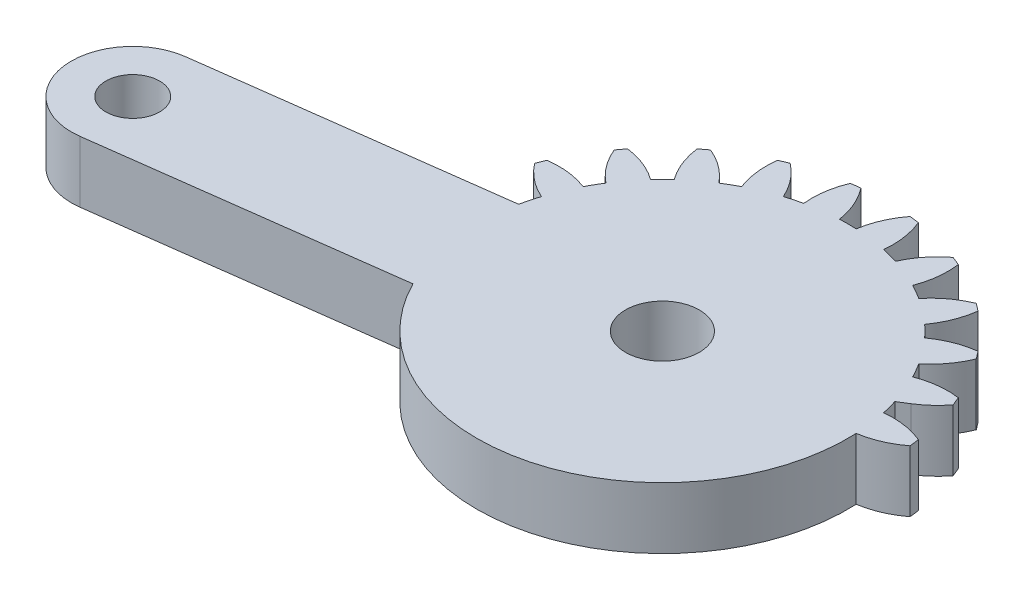
from build123d import *
from build123d.topology import SkipClean

# Parameters (mm, degrees)
SKETCH1_R           = 1.5
BOSS_EXTRUDE1_DEPTH = 4
BOSS_EXTRUDE2_START = -4
SKETCH3_R           = 1.5
SKETCH3_R_2         = 1.75
BOSS_EXTRUDE2_DEPTH = 4
CUT_EXTRUDE1_START  = -4
CUT_EXTRUDE1_DEPTH  = 4
CUT_EXTRUDE2_REACH  = 49.073
SKETCH5_R           = 2.4


with BuildPart() as part:
    # Sketch1 → Boss-Extrude1 (new body)
    with BuildSketch(Plane(origin=(0, 0, 0), x_dir=(1, 0, 0), z_dir=(0, 1, 0))):
        with BuildLine():
            Line((20.643657446, 4), (2.081641936, 4))
            ThreePointArc((2.081641936, 4), (2.861028333, 4.588201733), (3.521749436, 5.30713988))
            ThreePointArc((3.521749436, 5.30713988), (3.405395609, 5.596745198), (3.282888305, 5.883801663))
            ThreePointArc((3.282888305, 5.883801663), (1.93527598, 5.894040025), (0.627094961, 5.57027124))
            ThreePointArc((0.627094961, 5.57027124), (0.366286148, 6.046375), (0.084372603, 6.510293938))
            ThreePointArc((0.084372603, 6.510293938), (1.018855105, 7.48132754), (1.683794586, 8.65351323))
            ThreePointArc((1.683794586, 8.65351323), (1.496450048, 8.903135899), (1.303821399, 9.148703928))
            ThreePointArc((1.303821399, 9.148703928), (-0.000522033, 8.809805691), (-1.180330337, 8.158486898))
            ThreePointArc((-1.180330337, 8.158486898), (-1.555477026, 8.550865528), (-1.947855656, 8.926012217))
            ThreePointArc((-1.947855656, 8.926012217), (-1.296536862, 10.105820521), (-0.957638625, 11.410163953))
            ThreePointArc((-0.957638625, 11.410163953), (-1.203206655, 11.602792602), (-1.452829324, 11.79013714))
            ThreePointArc((-1.452829324, 11.79013714), (-2.625015014, 11.125197659), (-3.596048616, 10.190715157))
            ThreePointArc((-3.596048616, 10.190715157), (-4.059967554, 10.472628702), (-4.536071314, 10.733437515))
            ThreePointArc((-4.536071314, 10.733437515), (-4.212302529, 12.041618533), (-4.222540891, 13.389230859))
            ThreePointArc((-4.222540891, 13.389230859), (-4.509597355, 13.511738163), (-4.799202674, 13.62809199))
            ThreePointArc((-4.799202674, 13.62809199), (-5.759348103, 12.682425791), (-6.455432668, 11.528463019))
            ThreePointArc((-6.455432668, 11.528463019), (-6.976508546, 11.680699536), (-7.503891752, 11.809396783))
            ThreePointArc((-7.503891752, 11.809396783), (-7.529737283, 13.156800143), (-7.888414517, 14.455843809))
            ThreePointArc((-7.888414517, 14.455843809), (-8.197396993, 14.499881098), (-8.507248835, 14.537314892))
            ThreePointArc((-8.507248835, 14.537314892), (-9.18992168, 13.375367565), (-9.563620196, 12.080565177))
            ThreePointArc((-9.563620196, 12.080565177), (-10.106342554, 12.09275), (-10.649064912, 12.080565177))
            ThreePointArc((-10.649064912, 12.080565177), (-11.022763428, 13.375367565), (-11.705436272, 14.537314892))
            ThreePointArc((-11.705436272, 14.537314892), (-12.015288115, 14.499881098), (-12.324270591, 14.455843809))
            ThreePointArc((-12.324270591, 14.455843809), (-12.682947825, 13.156800143), (-12.708793355, 11.809396783))
            ThreePointArc((-12.708793355, 11.809396783), (-13.236176561, 11.680699536), (-13.757252439, 11.528463019))
            ThreePointArc((-13.757252439, 11.528463019), (-14.453337005, 12.682425791), (-15.413482434, 13.62809199))
            ThreePointArc((-15.413482434, 13.62809199), (-15.703087752, 13.511738163), (-15.990144217, 13.389230859))
            ThreePointArc((-15.990144217, 13.389230859), (-16.000382579, 12.041618533), (-15.676613793, 10.733437515))
            ThreePointArc((-15.676613793, 10.733437515), (-16.152717554, 10.472628702), (-16.616636492, 10.190715157))
            ThreePointArc((-16.616636492, 10.190715157), (-17.587670094, 11.125197659), (-18.759855783, 11.79013714))
            ThreePointArc((-18.759855783, 11.79013714), (-19.009478453, 11.602792602), (-19.255046482, 11.410163953))
            ThreePointArc((-19.255046482, 11.410163953), (-18.916148245, 10.105820521), (-18.264829452, 8.926012217))
            ThreePointArc((-18.264829452, 8.926012217), (-18.657208082, 8.550865528), (-19.032354771, 8.158486898))
            ThreePointArc((-19.032354771, 8.158486898), (-20.212163074, 8.809805691), (-21.516506507, 9.148703928))
            ThreePointArc((-21.516506507, 9.148703928), (-21.709135156, 8.903135899), (-21.896479694, 8.65351323))
            ThreePointArc((-21.896479694, 8.65351323), (-21.231540213, 7.48132754), (-20.297057711, 6.510293938))
            ThreePointArc((-20.297057711, 6.510293938), (-20.578971255, 6.046375), (-20.839780068, 5.57027124))
            ThreePointArc((-20.839780068, 5.57027124), (-22.147961087, 5.894040025), (-23.495573413, 5.883801663))
            ThreePointArc((-23.495573413, 5.883801663), (-23.618080717, 5.596745198), (-23.734434544, 5.30713988))
            ThreePointArc((-23.734434544, 5.30713988), (-22.788768345, 4.346994451), (-21.634805572, 3.650909885))
            ThreePointArc((-21.634805572, 3.650909885), (-21.78704209, 3.129834008), (-21.915739337, 2.602450802))
            ThreePointArc((-21.915739337, 2.602450802), (-23.263142697, 2.576605271), (-24.562186363, 2.217928037))
            ThreePointArc((-24.562186363, 2.217928037), (-24.606223651, 1.908945561), (-24.643657446, 1.599093719))
            ThreePointArc((-24.643657446, 1.599093719), (-23.481710119, 0.916420874), (-22.186907731, 0.542722358))
            ThreePointArc((-22.186907731, 0.542722358), (-22.199092554, 0), (-22.186907731, -0.542722358))
            ThreePointArc((-22.186907731, -0.542722358), (-23.481710119, -0.916420874), (-24.643657446, -1.599093719))
            ThreePointArc((-24.643657446, -1.599093719), (-24.606223651, -1.908945561), (-24.562186363, -2.217928037))
            ThreePointArc((-24.562186363, -2.217928037), (-23.263142697, -2.576605271), (-21.915739337, -2.602450802))
            ThreePointArc((-21.915739337, -2.602450802), (-21.78704209, -3.129834008), (-21.634805572, -3.650909885))
            ThreePointArc((-21.634805572, -3.650909885), (-22.788768345, -4.346994451), (-23.734434544, -5.30713988))
            ThreePointArc((-23.734434544, -5.30713988), (-23.618080717, -5.596745198), (-23.495573413, -5.883801663))
            ThreePointArc((-23.495573413, -5.883801663), (-22.147961087, -5.894040025), (-20.839780068, -5.57027124))
            ThreePointArc((-20.839780068, -5.57027124), (-20.578971255, -6.046375), (-20.297057711, -6.510293938))
            ThreePointArc((-20.297057711, -6.510293938), (-21.231540213, -7.48132754), (-21.896479694, -8.65351323))
            ThreePointArc((-21.896479694, -8.65351323), (-21.709135156, -8.903135899), (-21.516506507, -9.148703928))
            ThreePointArc((-21.516506507, -9.148703928), (-20.212163074, -8.809805691), (-19.032354771, -8.158486898))
            ThreePointArc((-19.032354771, -8.158486898), (-18.657208082, -8.550865528), (-18.264829452, -8.926012217))
            ThreePointArc((-18.264829452, -8.926012217), (-18.916148245, -10.105820521), (-19.255046482, -11.410163953))
            ThreePointArc((-19.255046482, -11.410163953), (-19.009478453, -11.602792602), (-18.759855783, -11.79013714))
            ThreePointArc((-18.759855783, -11.79013714), (-17.587670094, -11.125197659), (-16.616636492, -10.190715157))
            ThreePointArc((-16.616636492, -10.190715157), (-16.152717554, -10.472628702), (-15.676613793, -10.733437515))
            ThreePointArc((-15.676613793, -10.733437515), (-16.000382579, -12.041618533), (-15.990144217, -13.389230859))
            ThreePointArc((-15.990144217, -13.389230859), (-15.703087752, -13.511738163), (-15.413482434, -13.62809199))
            ThreePointArc((-15.413482434, -13.62809199), (-14.453337005, -12.682425791), (-13.757252439, -11.528463019))
            ThreePointArc((-13.757252439, -11.528463019), (-13.236176561, -11.680699536), (-12.708793355, -11.809396783))
            ThreePointArc((-12.708793355, -11.809396783), (-12.682947825, -13.156800143), (-12.324270591, -14.455843809))
            ThreePointArc((-12.324270591, -14.455843809), (-12.015288115, -14.499881098), (-11.705436272, -14.537314892))
            ThreePointArc((-11.705436272, -14.537314892), (-11.022763428, -13.375367565), (-10.649064912, -12.080565177))
            ThreePointArc((-10.649064912, -12.080565177), (-10.106342554, -12.09275), (-9.563620196, -12.080565177))
            ThreePointArc((-9.563620196, -12.080565177), (-9.18992168, -13.375367565), (-8.507248835, -14.537314892))
            ThreePointArc((-8.507248835, -14.537314892), (-8.197396993, -14.499881098), (-7.888414517, -14.455843809))
            ThreePointArc((-7.888414517, -14.455843809), (-7.529737283, -13.156800143), (-7.503891752, -11.809396783))
            ThreePointArc((-7.503891752, -11.809396783), (-6.976508546, -11.680699536), (-6.455432668, -11.528463019))
            ThreePointArc((-6.455432668, -11.528463019), (-5.759348103, -12.682425791), (-4.799202674, -13.62809199))
            ThreePointArc((-4.799202674, -13.62809199), (-4.509597355, -13.511738163), (-4.222540891, -13.389230859))
            ThreePointArc((-4.222540891, -13.389230859), (-4.212302529, -12.041618533), (-4.536071314, -10.733437515))
            ThreePointArc((-4.536071314, -10.733437515), (-4.059967554, -10.472628702), (-3.596048616, -10.190715157))
            ThreePointArc((-3.596048616, -10.190715157), (-2.625015014, -11.125197659), (-1.452829324, -11.79013714))
            ThreePointArc((-1.452829324, -11.79013714), (-1.203206655, -11.602792602), (-0.957638625, -11.410163953))
            ThreePointArc((-0.957638625, -11.410163953), (-1.296536862, -10.105820521), (-1.947855656, -8.926012217))
            ThreePointArc((-1.947855656, -8.926012217), (-1.555477026, -8.550865528), (-1.180330337, -8.158486898))
            ThreePointArc((-1.180330337, -8.158486898), (-0.000522033, -8.809805691), (1.303821399, -9.148703928))
            ThreePointArc((1.303821399, -9.148703928), (1.496450048, -8.903135899), (1.683794586, -8.65351323))
            ThreePointArc((1.683794586, -8.65351323), (1.018855105, -7.48132754), (0.084372603, -6.510293938))
            ThreePointArc((0.084372603, -6.510293938), (0.366286148, -6.046375), (0.627094961, -5.57027124))
            ThreePointArc((0.627094961, -5.57027124), (1.93527598, -5.894040025), (3.282888305, -5.883801663))
            ThreePointArc((3.282888305, -5.883801663), (3.405395609, -5.596745198), (3.521749436, -5.30713988))
            ThreePointArc((3.521749436, -5.30713988), (2.861028333, -4.588201733), (2.081641936, -4))
            Line((2.081641936, -4), (20.643657446, -4))
            ThreePointArc((20.643657446, -4), (24.643657446, 0), (20.643657446, 4))
        make_face()
        with Locations((-10.106342554, 0)):
            Circle(SKETCH1_R, mode=Mode.SUBTRACT)
        with Locations((20.643657446, 0)):
            Circle(SKETCH1_R, mode=Mode.SUBTRACT)
    extrude(amount=BOSS_EXTRUDE1_DEPTH)

    # Sketch3 → Boss-Extrude2 (add)
    with BuildSketch(Plane(origin=(0, 4, 0), x_dir=(1, 0, 0), z_dir=(0, 1, 0)).offset(BOSS_EXTRUDE2_START)):
        with BuildLine():
            Line((-10.628447323, 3.965779445), (-41.11537681, -0.047900965))
            ThreePointArc((-41.11537681, -0.047900965), (-44.559051487, -4.53578518), (-40.071167272, -7.979459856))
            Line((-40.071167272, -7.979459856), (-9.584237785, -3.965779445))
            ThreePointArc((-9.584237785, -3.965779445), (-6.140563108, 0.522104769), (-10.628447323, 3.965779445))
        make_face()
        with Locations((-10.106342554, 0)):
            Circle(SKETCH3_R, mode=Mode.SUBTRACT)
        with Locations((-40.593272041, -4.013680411)):
            Circle(SKETCH3_R_2, mode=Mode.SUBTRACT)
    extrude(amount=BOSS_EXTRUDE2_DEPTH)

    # Sketch4 → Cut-Extrude1 (cut)
    with SkipClean():  # the faces are left unmerged after this step: merging them gives an invalid solid
        with BuildSketch(Plane(origin=(0, 4, 0), x_dir=(1, 0, 0), z_dir=(0, 1, 0)).offset(CUT_EXTRUDE1_START)):
            with BuildLine():
                ThreePointArc((20.643657446, -4), (24.643657446, 0), (20.643657446, 4))
                Line((20.643657446, 4), (2.081641936, 4))
                Line((2.081641936, 4), (1.43808022, 3.600125745))
                ThreePointArc((1.43808022, 3.600125745), (1.581217534, 3.104116905), (1.70305423, 2.602450802))
                ThreePointArc((1.70305423, 2.602450802), (3.050457589, 2.576605271), (4.349501255, 2.217928037))
                ThreePointArc((4.349501255, 2.217928037), (4.393538544, 1.908945561), (4.430972339, 1.599093719))
                ThreePointArc((4.430972339, 1.599093719), (3.269025011, 0.916420874), (1.974222624, 0.542722358))
                ThreePointArc((1.974222624, 0.542722358), (1.70305423, -2.602450802), (0.627094961, -5.57027124))
                ThreePointArc((0.627094961, -5.57027124), (1.93527598, -5.894040025), (3.282888305, -5.883801663))
                ThreePointArc((3.282888305, -5.883801663), (3.405395609, -5.596745198), (3.521749436, -5.30713988))
                ThreePointArc((3.521749436, -5.30713988), (2.861028333, -4.588201733), (2.081641936, -4))
                Line((2.081641936, -4), (20.643657446, -4))
            make_face()
            with BuildLine():
                ThreePointArc((1.683794586, -8.65351323), (1.018855105, -7.48132754), (0.084372603, -6.510293938))
                ThreePointArc((0.084372603, -6.510293938), (-0.512518948, -7.361599771), (-1.180330337, -8.158486898))
                ThreePointArc((-1.180330337, -8.158486898), (-0.000522033, -8.809805691), (1.303821399, -9.148703928))
                ThreePointArc((1.303821399, -9.148703928), (1.496450048, -8.903135899), (1.683794586, -8.65351323))
            make_face()
            with BuildLine():
                ThreePointArc((-0.957638625, -11.410163953), (-1.296536862, -10.105820521), (-1.947855656, -8.926012217))
                ThreePointArc((-1.947855656, -8.926012217), (-2.744742783, -9.593823606), (-3.596048616, -10.190715157))
                ThreePointArc((-3.596048616, -10.190715157), (-2.625015014, -11.125197659), (-1.452829324, -11.79013714))
                ThreePointArc((-1.452829324, -11.79013714), (-1.203206655, -11.602792602), (-0.957638625, -11.410163953))
            make_face()
            with BuildLine():
                ThreePointArc((-4.222540891, -13.389230859), (-4.212302529, -12.041618533), (-4.536071314, -10.733437515))
                ThreePointArc((-4.536071314, -10.733437515), (-5.478647477, -11.172244217), (-6.455432668, -11.528463019))
                ThreePointArc((-6.455432668, -11.528463019), (-5.759348103, -12.682425791), (-4.799202674, -13.62809199))
                ThreePointArc((-4.799202674, -13.62809199), (-4.509597355, -13.511738163), (-4.222540891, -13.389230859))
            make_face()
            with BuildLine():
                ThreePointArc((-7.888414517, -14.455843809), (-7.529737283, -13.156800143), (-7.503891752, -11.809396783))
                ThreePointArc((-7.503891752, -11.809396783), (-8.527921943, -11.989294847), (-9.563620196, -12.080565177))
                ThreePointArc((-9.563620196, -12.080565177), (-9.18992168, -13.375367565), (-8.507248835, -14.537314892))
                ThreePointArc((-8.507248835, -14.537314892), (-8.197396993, -14.499881098), (-7.888414517, -14.455843809))
            make_face()
            with BuildLine():
                ThreePointArc((-11.705436272, -14.537314892), (-11.022763428, -13.375367565), (-10.649064912, -12.080565177))
                ThreePointArc((-10.649064912, -12.080565177), (-11.684763165, -11.989294847), (-12.708793355, -11.809396783))
                ThreePointArc((-12.708793355, -11.809396783), (-12.682947825, -13.156800143), (-12.324270591, -14.455843809))
                ThreePointArc((-12.324270591, -14.455843809), (-12.015288115, -14.499881098), (-11.705436272, -14.537314892))
            make_face()
            with BuildLine():
                ThreePointArc((-15.413482434, -13.62809199), (-14.453337005, -12.682425791), (-13.757252439, -11.528463019))
                ThreePointArc((-13.757252439, -11.528463019), (-14.734037631, -11.172244217), (-15.676613793, -10.733437515))
                ThreePointArc((-15.676613793, -10.733437515), (-16.000382579, -12.041618533), (-15.990144217, -13.389230859))
                ThreePointArc((-15.990144217, -13.389230859), (-15.703087752, -13.511738163), (-15.413482434, -13.62809199))
            make_face()
            with BuildLine():
                ThreePointArc((-18.759855783, -11.79013714), (-17.587670094, -11.125197659), (-16.616636492, -10.190715157))
                ThreePointArc((-16.616636492, -10.190715157), (-17.467942324, -9.593823606), (-18.264829452, -8.926012217))
                ThreePointArc((-18.264829452, -8.926012217), (-18.916148245, -10.105820521), (-19.255046482, -11.410163953))
                ThreePointArc((-19.255046482, -11.410163953), (-19.009478453, -11.602792602), (-18.759855783, -11.79013714))
            make_face()
            with BuildLine():
                ThreePointArc((-21.516506507, -9.148703928), (-20.212163074, -8.809805691), (-19.032354771, -8.158486898))
                ThreePointArc((-19.032354771, -8.158486898), (-19.70016616, -7.361599771), (-20.297057711, -6.510293938))
                ThreePointArc((-20.297057711, -6.510293938), (-21.231540213, -7.48132754), (-21.896479694, -8.65351323))
                ThreePointArc((-21.896479694, -8.65351323), (-21.709135156, -8.903135899), (-21.516506507, -9.148703928))
            make_face()
            with BuildLine():
                ThreePointArc((-21.942853375, 2.47620963), (-21.92946485, 2.539366405), (-21.915739337, 2.602450802))
                ThreePointArc((-21.915739337, 2.602450802), (-23.263142697, 2.576605271), (-24.562186363, 2.217928037))
                ThreePointArc((-24.562186363, 2.217928037), (-24.56889027, 2.173784387), (-24.575459377, 2.129620475))
                Line((-24.575459377, 2.129620475), (-21.942853375, 2.47620963))
            make_face()
            with BuildLine():
                ThreePointArc((-23.495573413, -5.883801663), (-22.147961087, -5.894040025), (-20.839780068, -5.57027124))
                ThreePointArc((-20.839780068, -5.57027124), (-20.869365339, -5.512888815), (-20.898643838, -5.455349261))
                Line((-20.898643838, -5.455349261), (-23.531249839, -5.801938416))
                ThreePointArc((-23.531249839, -5.801938416), (-23.513474108, -5.842897269), (-23.495573413, -5.883801663))
            make_face()
        extrude(amount=CUT_EXTRUDE1_DEPTH, mode=Mode.SUBTRACT)

    # Sketch5 → Cut-Extrude2 (cut, up to next)
    with BuildSketch(Plane(origin=(0, 4, 0), x_dir=(1, 0, 0), z_dir=(0, 1, 0)), mode=Mode.PRIVATE) as cut_extrude2_sk1:
        with Locations((-10.106342554, 0)):
            Circle(SKETCH5_R)
    cut_extrude2_tool1 = extrude(cut_extrude2_sk1.sketch, amount=-CUT_EXTRUDE2_REACH, mode=Mode.PRIVATE) & part.part
    add(cut_extrude2_tool1.solids().sort_by_distance((-10.106343, 4, 0))[0], mode=Mode.SUBTRACT)


solid = part.part
